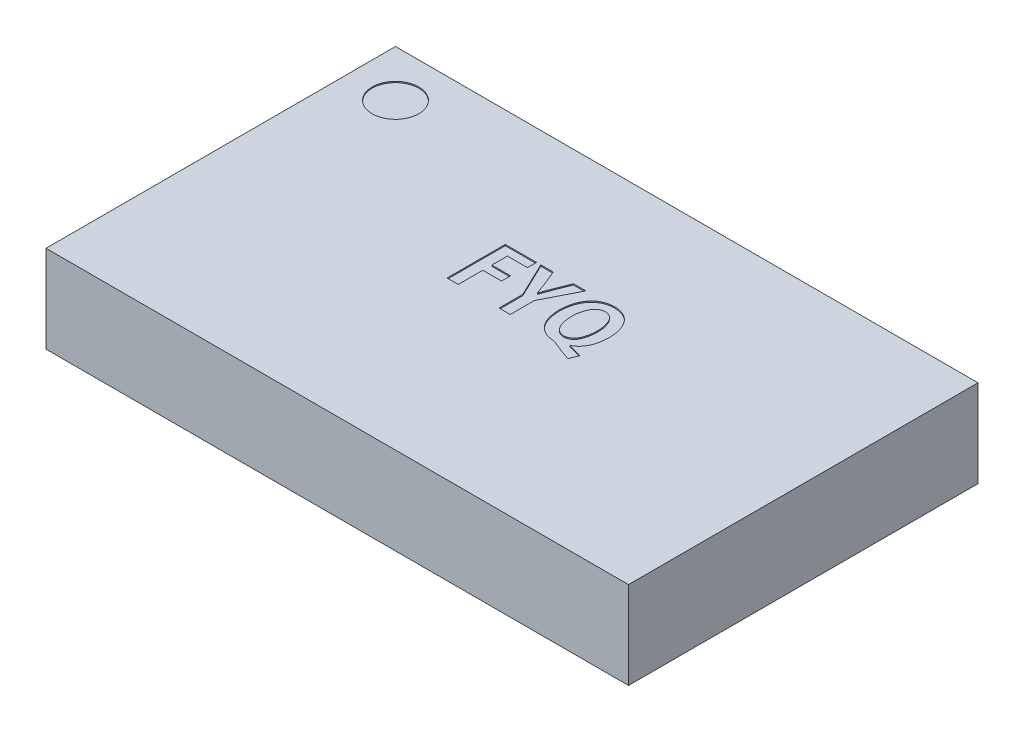
from build123d import *

# Parameters (mm, degrees)
SKETCH2_W           = 5
SKETCH2_H           = 3
BOSS_EXTRUDE1_DEPTH = 0.75
SKETCH1_W           = 3.8
SKETCH1_H           = 1.7
SKETCH1_W_2         = 0.25
SKETCH1_H_2         = 0.25
SKETCH1_W_3         = 0.249524266
SKETCH1_H_3         = 0.260764098
BOSS_EXTRUDE2_DEPTH = 0.05
WRAP1_START         = -0.01
WRAP1_OUTLINE_R     = 0.2
WRAP1_DEPTH         = 0.01


# Read off the part's stored shape, not the designer's step: Wrap1
with BuildPart() as part:
    # Sketch2 → Boss-Extrude1 (new body)
    with BuildSketch(Plane(origin=(0, 0, 0), x_dir=(1, 0, 0), z_dir=(0, 1, 0))):
        Rectangle(SKETCH2_W, SKETCH2_H)
    extrude(amount=BOSS_EXTRUDE1_DEPTH)

    # Sketch1 → Boss-Extrude2 (add)
    with BuildSketch(Plane(origin=(0, 0, 0), x_dir=(1, 0, 0), z_dir=(0, 1, 0))):
        Rectangle(SKETCH1_W, SKETCH1_H)
        with Locations((-0.25, -1.275)):
            Rectangle(SKETCH1_W_2, SKETCH1_H_2)
        with Locations((-0.75, -1.275)):
            Rectangle(SKETCH1_W_2, SKETCH1_H_2)
        with Locations((-1.25, -1.275)):
            Rectangle(SKETCH1_W_2, SKETCH1_H_2)
        with Locations((-1.75, -1.275)):
            Rectangle(SKETCH1_W_2, SKETCH1_H_2)
        with Locations((1.75, -1.275)):
            Rectangle(SKETCH1_W_2, SKETCH1_H_2)
        with Locations((1.25, -1.275)):
            Rectangle(SKETCH1_W_2, SKETCH1_H_2)
        with Locations((0.75, -1.275)):
            Rectangle(SKETCH1_W_2, SKETCH1_H_2)
        with Locations((0.25, -1.275)):
            Rectangle(SKETCH1_W_2, SKETCH1_H_2)
        with Locations((2.275237867, 0.25)):
            Rectangle(SKETCH1_W_3, SKETCH1_H_3)
        with Locations((2.275237867, 0.75)):
            Rectangle(SKETCH1_W_3, SKETCH1_H_3)
        with Locations((2.275237867, -0.25)):
            Rectangle(SKETCH1_W_3, SKETCH1_H_3)
        with Locations((2.275237867, -0.75)):
            Rectangle(SKETCH1_W_3, SKETCH1_H_3)
        with Locations((0.25, 1.275)):
            Rectangle(SKETCH1_W_2, SKETCH1_H_2)
        with Locations((0.75, 1.275)):
            Rectangle(SKETCH1_W_2, SKETCH1_H_2)
        with Locations((1.25, 1.275)):
            Rectangle(SKETCH1_W_2, SKETCH1_H_2)
        with Locations((1.75, 1.275)):
            Rectangle(SKETCH1_W_2, SKETCH1_H_2)
        with Locations((-1.75, 1.275)):
            Rectangle(SKETCH1_W_2, SKETCH1_H_2)
        with Locations((-1.25, 1.275)):
            Rectangle(SKETCH1_W_2, SKETCH1_H_2)
        with Locations((-0.75, 1.275)):
            Rectangle(SKETCH1_W_2, SKETCH1_H_2)
        with Locations((-0.25, 1.275)):
            Rectangle(SKETCH1_W_2, SKETCH1_H_2)
        with Locations((-2.275237867, -0.75)):
            Rectangle(SKETCH1_W_3, SKETCH1_H_3)
        with Locations((-2.275237867, -0.25)):
            Rectangle(SKETCH1_W_3, SKETCH1_H_3)
        with Locations((-2.275237867, 0.75)):
            Rectangle(SKETCH1_W_3, SKETCH1_H_3)
        with Locations((-2.275237867, 0.25)):
            Rectangle(SKETCH1_W_3, SKETCH1_H_3)
    extrude(amount=-BOSS_EXTRUDE2_DEPTH)

    # Wrap1 outline → Wrap1 (cut)
    # profile 1 of 4: a face of its own
    with BuildSketch(Plane(origin=(0, 0.75, 0), x_dir=(1, 0, 0), z_dir=(0, 1, 0)).offset(WRAP1_START)):
        with BuildLine():
            Line((-0.057598039, 0.2760181), (-0.058815704, 0.276067351))
            add(Edge.make_bspline(
                [(-0.058815704, 0.276067351), (-0.061713266, 0.28451331), (-0.067475318, 0.30130883), (-0.076626929, 0.326389529), (-0.086247611, 0.351748288), (-0.092989565, 0.368755422), (-0.096436652, 0.37745098)],
                knots=[0, 0, 0, 0, 0.247679597, 0.49253231, 0.740537402, 1, 1, 1, 1], degree=3))
            Line((-0.096436652, 0.37745098), (-0.145771378, 0.500376982))
            Line((-0.145771378, 0.500376982), (-0.253284391, 0.500376982))
            Line((-0.253284391, 0.500376982), (-0.111236894, 0.203893693))
            Line((-0.111236894, 0.203893693), (-0.111236894, 0.000376982))
            Line((-0.111236894, 0.000376982), (-0.01546003, 0.000376982))
            Line((-0.01546003, 0.000376982), (-0.01546003, 0.207144759))
            Line((-0.01546003, 0.207144759), (0.133103407, 0.500376982))
            Line((0.133103407, 0.500376982), (0.026893581, 0.500376982))
            Line((0.026893581, 0.500376982), (-0.021279544, 0.378150813))
            add(Edge.make_bspline(
                [(-0.021279544, 0.378150813), (-0.024782438, 0.369353865), (-0.031680092, 0.35203153), (-0.041214963, 0.326192782), (-0.049778642, 0.300925733), (-0.055020276, 0.284229215), (-0.057598039, 0.2760181)],
                knots=[0, 0, 0, 0, 0.261963096, 0.515839374, 0.761896517, 1, 1, 1, 1], degree=3))
        make_face()
    # profile 2 of 4: a face of its own
    with BuildSketch(Plane(origin=(0, 0.75, 0), x_dir=(1, 0, 0), z_dir=(0, 1, 0)).offset(WRAP1_START)):
        with BuildLine():
            Line((0.472567873, 0.025452489), (0.472597424, 0.028756304))
            add(Edge.make_bspline(
                [(0.472597424, 0.028756304), (0.476560457, 0.030619185), (0.484527311, 0.034364121), (0.49569217, 0.041528084), (0.506370725, 0.049704284), (0.516455489, 0.059032029), (0.525883015, 0.069613942), (0.534909202, 0.08119763), (0.543116653, 0.094084549), (0.550913885, 0.107941791), (0.557852908, 0.122950835), (0.56400396, 0.139000685), (0.56914307, 0.15612709), (0.573480628, 0.174218981), (0.576880106, 0.193357686), (0.579250789, 0.213505525), (0.580926412, 0.234701466), (0.581208925, 0.249179652), (0.581353695, 0.256598793)],
                knots=[0, 0, 0, 0, 0.049241388, 0.098989578, 0.148930996, 0.200486823, 0.253325887, 0.30829172, 0.365581903, 0.425113093, 0.487138594, 0.551507515, 0.618411944, 0.688238272, 0.7608053, 0.837047246, 0.91649716, 1, 1, 1, 1], degree=3))
            add(Edge.make_bspline(
                [(0.581353695, 0.256598793), (0.581179741, 0.265088085), (0.580838237, 0.281754116), (0.578475819, 0.306273077), (0.57444347, 0.329749062), (0.568771786, 0.352223365), (0.561495965, 0.373691875), (0.552669866, 0.394189977), (0.542100127, 0.413612673), (0.530159209, 0.431964328), (0.516546961, 0.448845635), (0.501095122, 0.463606295), (0.484083874, 0.476281356), (0.46544555, 0.486714815), (0.4451895, 0.494920386), (0.423408328, 0.501020623), (0.400027113, 0.505060249), (0.383877756, 0.505889281), (0.375565611, 0.506315988)],
                knots=[0, 0, 0, 0, 0.070052666, 0.137526183, 0.203050155, 0.266445557, 0.328603268, 0.389926179, 0.450377189, 0.510863227, 0.570396828, 0.628902771, 0.686729549, 0.745011522, 0.804674308, 0.866651639, 0.931365017, 1, 1, 1, 1], degree=3))
            add(Edge.make_bspline(
                [(0.375565611, 0.506315988), (0.367349056, 0.505949722), (0.35133405, 0.505235827), (0.328051809, 0.501373937), (0.306143842, 0.495455137), (0.285575714, 0.487371257), (0.266490234, 0.476958504), (0.248687393, 0.464575794), (0.232440891, 0.449829959), (0.217649124, 0.433093073), (0.204423417, 0.414658298), (0.192832579, 0.394753828), (0.183178243, 0.373415585), (0.175014064, 0.350839531), (0.168715035, 0.326889699), (0.164256716, 0.30163188), (0.161363974, 0.275046441), (0.160880778, 0.256857761), (0.160633484, 0.24754902)],
                knots=[0, 0, 0, 0, 0.065300567, 0.127278291, 0.18705722, 0.245334012, 0.302420491, 0.359423925, 0.417230337, 0.476300184, 0.536581158, 0.597216282, 0.658997074, 0.722412402, 0.787754955, 0.855484072, 0.926038542, 1, 1, 1, 1], degree=3))
            add(Edge.make_bspline(
                [(0.160633484, 0.24754902), (0.160985263, 0.237581037), (0.161669264, 0.218199185), (0.164643833, 0.190054624), (0.169454167, 0.163785063), (0.175817927, 0.139326816), (0.183888432, 0.116701552), (0.193724258, 0.095962797), (0.205144718, 0.076983623), (0.218402482, 0.060075801), (0.232802619, 0.044981142), (0.248189594, 0.031804562), (0.264319758, 0.020384242), (0.281419374, 0.011023957), (0.299313697, 0.003483502), (0.318125529, -0.001906079), (0.337713704, -0.005747331), (0.351132261, -0.006562473), (0.357937406, -0.006975867)],
                knots=[0, 0, 0, 0, 0.083259719, 0.161891097, 0.236043058, 0.306042313, 0.372681103, 0.436286465, 0.497388809, 0.557215047, 0.615295225, 0.671297505, 0.726104674, 0.780000036, 0.833742566, 0.88787177, 0.943134806, 1, 1, 1, 1], degree=3))
            add(Edge.make_bspline(
                [(0.357937406, -0.006975867), (0.36020806, -0.007207589), (0.364922803, -0.007688731), (0.372085062, -0.009463333), (0.379613965, -0.012041319), (0.384632329, -0.014286637), (0.387254902, -0.01546003)],
                knots=[0, 0, 0, 0, 0.222893123, 0.462810885, 0.719267479, 1, 1, 1, 1], degree=3))
            add(Edge.make_bspline(
                [(0.387254902, -0.01546003), (0.401173457, -0.021447903), (0.42916892, -0.033491774), (0.472044728, -0.050202771), (0.515827503, -0.066121357), (0.545564385, -0.075754579), (0.560520362, -0.080599548)],
                knots=[0, 0, 0, 0, 0.245437291, 0.493666953, 0.745343, 1, 1, 1, 1], degree=3))
            Line((0.560520362, -0.080599548), (0.589889227, -0.005656201))
            add(Edge.make_bspline(
                [(0.589889227, -0.005656201), (0.580346038, -0.003382338), (0.560905513, 0.001249769), (0.531555619, 0.00864298), (0.501909803, 0.016471769), (0.482322224, 0.022466963), (0.472567873, 0.025452489)],
                knots=[0, 0, 0, 0, 0.242424035, 0.493844408, 0.747941317, 1, 1, 1, 1], degree=3))
        make_face()
        with BuildLine():
            add(Edge.make_bspline(
                [(0.372337008, 0.428732848), (0.376725947, 0.42836378), (0.38535691, 0.427637999), (0.397816924, 0.424827899), (0.409411116, 0.4204118), (0.420143813, 0.41456552), (0.42998088, 0.407058651), (0.438938863, 0.398099752), (0.446934411, 0.387522515), (0.45396211, 0.375599437), (0.460263781, 0.362637486), (0.465573994, 0.348816258), (0.47022721, 0.334383997), (0.473993305, 0.31923418), (0.476898216, 0.303395883), (0.478950455, 0.286871763), (0.480205646, 0.269690423), (0.480329257, 0.258014995), (0.480392157, 0.252073906)],
                knots=[0, 0, 0, 0, 0.057442733, 0.112962612, 0.166055518, 0.218919808, 0.271911229, 0.327014448, 0.383780774, 0.444483752, 0.507402057, 0.571685148, 0.6375771, 0.705220093, 0.775287851, 0.847628332, 0.922465067, 1, 1, 1, 1], degree=3))
            add(Edge.make_bspline(
                [(0.480392157, 0.252073906), (0.480300449, 0.245692479), (0.480121348, 0.233229882), (0.478760188, 0.214983451), (0.476666873, 0.197595092), (0.473491985, 0.181093156), (0.469714682, 0.165373193), (0.46486441, 0.150597401), (0.459329586, 0.136630454), (0.452885157, 0.123667642), (0.445558321, 0.111871913), (0.437488051, 0.101423055), (0.428534869, 0.092525777), (0.418739695, 0.085176388), (0.408090282, 0.07939807), (0.39665384, 0.075088525), (0.384381483, 0.072453339), (0.375923397, 0.071855113), (0.371606335, 0.071549774)],
                knots=[0, 0, 0, 0, 0.081815392, 0.159781204, 0.234493451, 0.30624525, 0.375138027, 0.441648576, 0.505468696, 0.567633044, 0.626997595, 0.683255045, 0.736532087, 0.788346285, 0.839731043, 0.891367921, 0.944553474, 1, 1, 1, 1], degree=3))
            add(Edge.make_bspline(
                [(0.371606335, 0.071549774), (0.3672548, 0.071841165), (0.358752383, 0.072410512), (0.346453929, 0.075231779), (0.33495383, 0.079458486), (0.324265511, 0.085293193), (0.31442389, 0.092643367), (0.305252862, 0.10137686), (0.29706734, 0.111789101), (0.289687084, 0.123548623), (0.28315295, 0.136458045), (0.277389348, 0.150217304), (0.272593294, 0.164823512), (0.268654205, 0.18019574), (0.265539392, 0.196377376), (0.263320775, 0.213344481), (0.261843435, 0.231120346), (0.26167903, 0.243241018), (0.261595023, 0.249434389)],
                knots=[0, 0, 0, 0, 0.056318415, 0.110039947, 0.162492729, 0.214310636, 0.266887588, 0.320912487, 0.377577193, 0.437658241, 0.500167275, 0.564457357, 0.630370349, 0.698761374, 0.769521572, 0.843303809, 0.919932016, 1, 1, 1, 1], degree=3))
            add(Edge.make_bspline(
                [(0.261595023, 0.249434389), (0.261700004, 0.255375023), (0.261906301, 0.267048836), (0.263103617, 0.284270314), (0.265284076, 0.3008523), (0.268280933, 0.316816382), (0.272155468, 0.332115247), (0.276822712, 0.346793556), (0.282577956, 0.360746017), (0.288816844, 0.374101994), (0.296118686, 0.386335203), (0.304319062, 0.397168413), (0.313425284, 0.406466047), (0.323519412, 0.414022845), (0.334418317, 0.420205268), (0.346246452, 0.424680406), (0.358957695, 0.427713156), (0.367755549, 0.428325047), (0.372337008, 0.428732848)],
                knots=[0, 0, 0, 0, 0.076319068, 0.149972976, 0.221621801, 0.291053072, 0.358508348, 0.42425097, 0.488715895, 0.552269483, 0.613466766, 0.671354118, 0.726443446, 0.780050183, 0.832823668, 0.886873875, 0.942000163, 1, 1, 1, 1], degree=3))
        make_face(mode=Mode.SUBTRACT)
    # profile 3 of 4: a face of its own
    with BuildSketch(Plane(origin=(0, 0.75, 0), x_dir=(1, 0, 0), z_dir=(0, 1, 0)).offset(WRAP1_START)):
        Polygon((-0.461915535, 0.211538369), (-0.301623406, 0.211538369), (-0.301623406, 0.289215594), (-0.461915535, 0.289215594), (-0.461915535, 0.422699665), (-0.289894714, 0.422699665), (-0.289894714, 0.500376982), (-0.5576924, 0.500376982), (-0.5576924, 0.000376982), (-0.461915535, 0.000376982), align=None)
    # profile 4 of 4: a face of its own
    with BuildSketch(Plane(origin=(0, 0.75, 0), x_dir=(1, 0, 0), z_dir=(0, 1, 0)).offset(WRAP1_START)):
        with Locations((-2.1, 1.1)):
            Circle(WRAP1_OUTLINE_R)
    extrude(amount=WRAP1_DEPTH, mode=Mode.SUBTRACT)


solid = part.part
